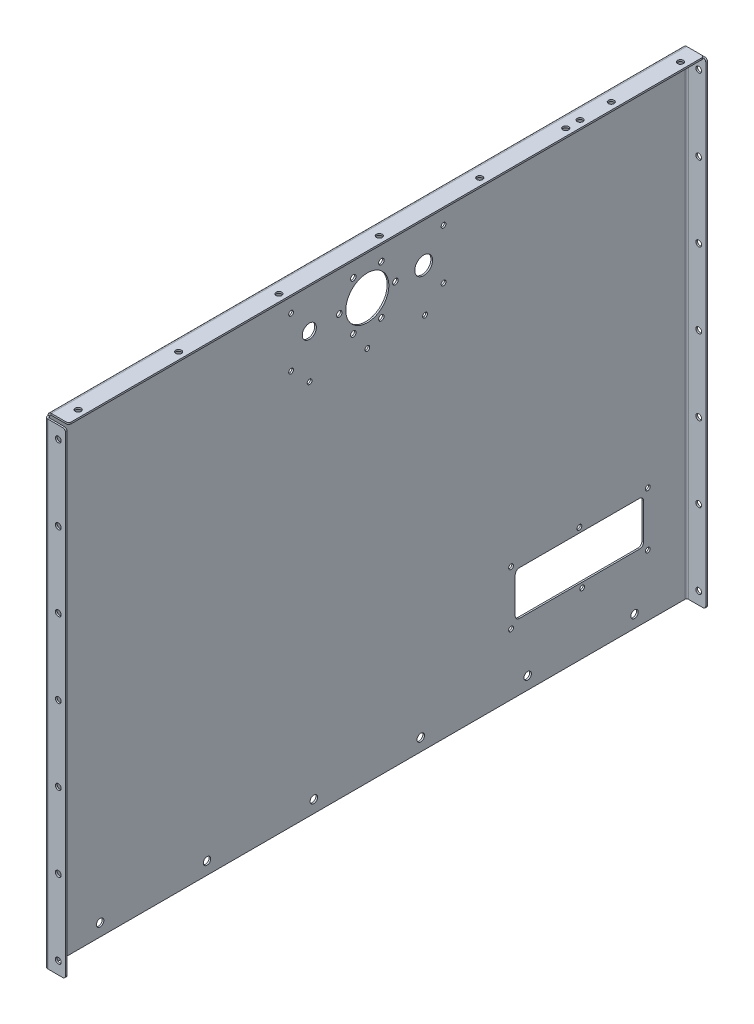
from build123d import *

# Parameters (mm, degrees)
BASE_FLANGE1_DEPTH           = 574.9
EDGE_FLANGE1_DEPTH           = 767
F_7_0_7_DIAMETER_HOLE1_D     = 7
F_7_0_7_DIAMETER_HOLE1_DEPTH = 2
LPATTERN1_COUNT              = 7
LPATTERN1_PITCH              = 90.816666667
MIRROR1_COPY_1_D             = 7
MIRROR1_COPY_1_DEPTH         = 2
MIRROR1_COPY_2_D             = 7
MIRROR1_COPY_2_DEPTH         = 2
MIRROR1_COPY_3_D             = 7
MIRROR1_COPY_3_DEPTH         = 2
MIRROR1_COPY_4_D             = 7
MIRROR1_COPY_4_DEPTH         = 2
MIRROR1_COPY_5_D             = 7
MIRROR1_COPY_5_DEPTH         = 2
MIRROR1_COPY_6_D             = 7
MIRROR1_COPY_6_DEPTH         = 2
F_7_0_7_DIAMETER_HOLE2_D     = 7
LPATTERN2_COUNT              = 7
LPATTERN2_PITCH              = 121.166666667
M8_CLEARANCE_HOLE1_D         = 9
LPATTERN3_COUNT              = 6
LPATTERN3_PITCH              = 129
F_7_0_7_DIAMETER_HOLE3_D     = 7
SKETCH21_R                   = 26
CUT_EXTRUDE1_DEPTH           = 20
M6_CLEARANCE_HOLE1_D         = 6.6
M5_CLEARANCE_HOLE1_D         = 5.8
SKETCH26_R                   = 10.75
CUT_EXTRUDE2_DEPTH           = 10
M16_CLEARANCE_HOLE1_D        = 17
CUT_EXTRUDE3_DEPTH           = 10
M5_CLEARANCE_HOLE2_D         = 5.8
FILLET1_R                    = 3


# Sheet-metal steps are written as plain solids
with BuildPart() as part:
    # Sketch1 → Base-Flange1 (new body)
    with BuildSketch(Plane(origin=(0, 0, 0), x_dir=(1, 0, 0), z_dir=(0, 1, 0))):
        with BuildLine():
            Line((25, 387.5), (4, 387.5))
            ThreePointArc((4, 387.5), (1.171572875, 386.328427125), (0, 383.5))
            Line((0, 383.5), (0, -383.5))
            ThreePointArc((0, -383.5), (1.171572875, -386.328427125), (4, -387.5))
            Line((4, -387.5), (25, -387.5))
            Line((25, -387.5), (25, -385.5))
            Line((25, -385.5), (4, -385.5))
            ThreePointArc((4, -385.5), (2.585786438, -384.914213562), (2, -383.5))
            Line((2, -383.5), (2, 383.5))
            ThreePointArc((2, 383.5), (2.585786438, 384.914213562), (4, 385.5))
            Line((4, 385.5), (25, 385.5))
            Line((25, 385.5), (25, 387.5))
        make_face()
    extrude(amount=BASE_FLANGE1_DEPTH)

    # Edge-Flange1 section (across the edge) → Edge-Flange1 (add)
    with BuildSketch(Plane(origin=(2, 576.9, -383.5), x_dir=(0, -1, 0), z_dir=(0, 0, 1))):
        with BuildLine():
            Line((-2, 2), (-2, 23))
            Line((-2, 23), (0, 23))
            Line((0, 23), (0, 2))
            ThreePointArc((0, 2), (0.585786438, 0.585786438), (2, 0))
            Line((2, 0), (2, -2))
            ThreePointArc((2, -2), (-0.828427125, -0.828427125), (-2, 2))
        make_face()
    extrude(amount=EDGE_FLANGE1_DEPTH)

    # Ø7.0 (7) Diameter Hole1
    with Locations(Plane(origin=(0, 0, 385.5), x_dir=(-1, 0, 0), z_dir=(0, 0, -1))):
        with Locations((-16.5, 559.9)):
            f_7_0_7_diameter_hole1 = Hole(F_7_0_7_DIAMETER_HOLE1_D / 2, depth=F_7_0_7_DIAMETER_HOLE1_DEPTH)

    # LPattern1: Ø7.0 (7) Diameter Hole1 ×7
    with Locations(*[(0, -i * LPATTERN1_PITCH, 0) for i in range(1, LPATTERN1_COUNT)]):
        add(f_7_0_7_diameter_hole1, mode=Mode.SUBTRACT)

    # Mirror1: Ø7.0 (7) Diameter Hole1 across plane
    add(f_7_0_7_diameter_hole1.mirror(Plane.XY), mode=Mode.SUBTRACT)

    # Mirror1 copy 1
    with Locations(Plane(origin=(0, -90.816666667, -385.5), x_dir=(-1, 0, 0), z_dir=(0, 0, 1))):
        with Locations((-16.5, -559.9)):
            Hole(MIRROR1_COPY_1_D / 2, depth=MIRROR1_COPY_1_DEPTH)

    # Mirror1 copy 2
    with Locations(Plane(origin=(0, -181.633333333, -385.5), x_dir=(-1, 0, 0), z_dir=(0, 0, 1))):
        with Locations((-16.5, -559.9)):
            Hole(MIRROR1_COPY_2_D / 2, depth=MIRROR1_COPY_2_DEPTH)

    # Mirror1 copy 3
    with Locations(Plane(origin=(0, -272.45, -385.5), x_dir=(-1, 0, 0), z_dir=(0, 0, 1))):
        with Locations((-16.5, -559.9)):
            Hole(MIRROR1_COPY_3_D / 2, depth=MIRROR1_COPY_3_DEPTH)

    # Mirror1 copy 4
    with Locations(Plane(origin=(0, -363.266666667, -385.5), x_dir=(-1, 0, 0), z_dir=(0, 0, 1))):
        with Locations((-16.5, -559.9)):
            Hole(MIRROR1_COPY_4_D / 2, depth=MIRROR1_COPY_4_DEPTH)

    # Mirror1 copy 5
    with Locations(Plane(origin=(0, -454.083333333, -385.5), x_dir=(-1, 0, 0), z_dir=(0, 0, 1))):
        with Locations((-16.5, -559.9)):
            Hole(MIRROR1_COPY_5_D / 2, depth=MIRROR1_COPY_5_DEPTH)

    # Mirror1 copy 6
    with Locations(Plane(origin=(0, -544.9, -385.5), x_dir=(-1, 0, 0), z_dir=(0, 0, 1))):
        with Locations((-16.5, -559.9)):
            Hole(MIRROR1_COPY_6_D / 2, depth=MIRROR1_COPY_6_DEPTH)

    # Ø7.0 (7) Diameter Hole2 (through all)
    with Locations(Plane(origin=(0, 578.9, 0), x_dir=(1, 0, 0), z_dir=(0, 1, 0))):
        with Locations((16.5, -363.5)):
            f_7_0_7_diameter_hole2 = Hole(F_7_0_7_DIAMETER_HOLE2_D / 2)

    # LPattern2: Ø7.0 (7) Diameter Hole2 ×7
    with Locations(*[(0, 0, -i * LPATTERN2_PITCH) for i in range(1, LPATTERN2_COUNT)]):
        add(f_7_0_7_diameter_hole2, mode=Mode.SUBTRACT)

    # M8 Clearance Hole1 (through all)
    with Locations(Plane(origin=(2, 0, 0), x_dir=(0, 0, -1), z_dir=(1, 0, 0))):
        with Locations((-322.5, 15)):
            m8_clearance_hole1 = Hole(M8_CLEARANCE_HOLE1_D / 2)

    # LPattern3: M8 Clearance Hole1 ×6
    with Locations(*[(0, 0, -i * LPATTERN3_PITCH) for i in range(1, LPATTERN3_COUNT)]):
        add(m8_clearance_hole1, mode=Mode.SUBTRACT)

    # Ø7.0 (7) Diameter Hole3 (through all)
    with Locations(Plane(origin=(0, 578.9, 0), x_dir=(1, 0, 0), z_dir=(0, 1, 0))):
        with Locations((16.5, 280), (16.5, 225)):
            Hole(F_7_0_7_DIAMETER_HOLE3_D / 2)

    # Sketch21 → Cut-Extrude1 (cut)
    with BuildSketch(Plane(origin=(2, 0, 0), x_dir=(0, 0, -1), z_dir=(1, 0, 0))):
        with Locations((0, 506.9)):
            Circle(SKETCH21_R)
    extrude(amount=-CUT_EXTRUDE1_DEPTH, mode=Mode.SUBTRACT)

    # M6 Clearance Hole1 (through all)
    with Locations(Plane(origin=(2, 0, 0), x_dir=(0, 0, -1), z_dir=(1, 0, 0))):
        with Locations((-33.875, 506.9), (-16.9375, 536.236610553), (-16.9375, 477.563389447), (16.9375, 477.563389447), (16.9375, 536.236610553), (33.875, 506.9)):
            Hole(M6_CLEARANCE_HOLE1_D / 2)

    # M5 Clearance Hole1 (through all)
    with Locations(Plane.ZY):
        with Locations((-69.646446609, 453.961547076), (-92, 476.290170104), (-92, 536.731392746), (0, 453.961547076), (69.646446609, 453.961547076), (92, 476.290170104), (92, 536.731392746), (69.646446609, 559.060015773), (0, 559.060015773), (-69.646446609, 559.060015773)):
            Hole(M5_CLEARANCE_HOLE1_D / 2)

    # Sketch26 → Cut-Extrude2 (cut)
    with BuildSketch(Plane(origin=(2, 0, 0), x_dir=(0, 0, -1), z_dir=(1, 0, 0))):
        with Locations((68, 506.9)):
            Circle(SKETCH26_R)
    extrude(amount=-CUT_EXTRUDE2_DEPTH, mode=Mode.SUBTRACT)

    # M16 Clearance Hole1 (through all)
    with Locations(Plane(origin=(2, 0, 0), x_dir=(0, 0, -1), z_dir=(1, 0, 0))):
        with Locations((-70, 506.9)):
            Hole(M16_CLEARANCE_HOLE1_D / 2)

    # Sketch29 → Cut-Extrude3 (cut)
    with BuildSketch(Plane(origin=(2, 0, 0), x_dir=(0, 0, -1), z_dir=(1, 0, 0))):
        with BuildLine():
            Line((183.5, 80), (328.5, 80))
            ThreePointArc((328.5, 80), (332.035533906, 81.464466094), (333.5, 85))
            Line((333.5, 85), (333.5, 128))
            ThreePointArc((333.5, 128), (332.035533906, 131.535533906), (328.5, 133))
            Line((328.5, 133), (183.5, 133))
            ThreePointArc((183.5, 133), (179.964466094, 131.535533906), (178.5, 128))
            Line((178.5, 128), (178.5, 85))
            ThreePointArc((178.5, 85), (179.964466094, 81.464466094), (183.5, 80))
        make_face()
    extrude(amount=-CUT_EXTRUDE3_DEPTH, mode=Mode.SUBTRACT)

    # M5 Clearance Hole2 (through all)
    with Locations(Plane(origin=(2, 0, 0), x_dir=(0, 0, -1), z_dir=(1, 0, 0))):
        with Locations((256, 138.999355653), (173.5, 138.999355653), (338.5, 138.999355653), (338.5, 74.000644347), (259.364988053, 74.000644347), (173.5, 74.000644347)):
            Hole(M5_CLEARANCE_HOLE2_D / 2)

    # Fillet1
    fillet1_edges = [part.edges().sort_by_distance(p)[0] for p in [
        (25, 0, -386.5),
        (25, 0, 386.5),
        (25, 574.9, -386.5),
        (25, 577.9, -383.5),
        (25, 577.9, 383.5),
        (25, 574.9, 386.5),
    ]]
    fillet(fillet1_edges, radius=FILLET1_R)


solid = part.part
